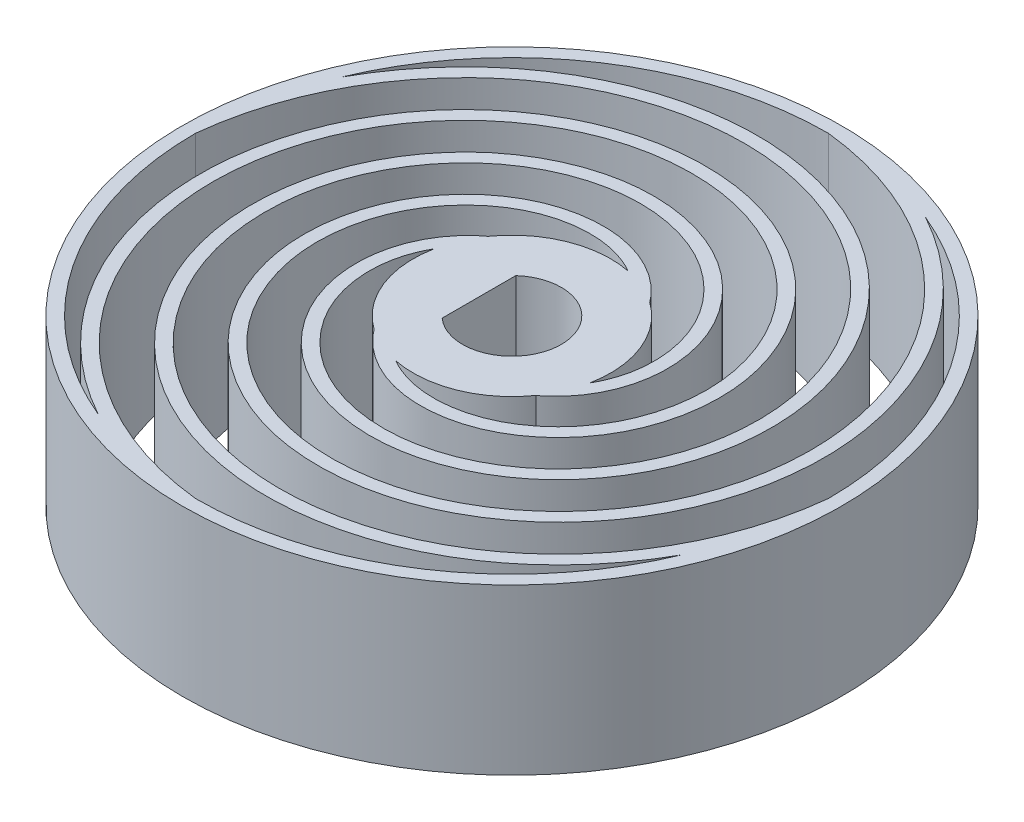
from build123d import *

# Parameters (mm, degrees)
SWEEP1_DEPTH        = 5
CIRPATTERN1_COUNT   = 4
SKETCH1_R           = 10
SKETCH1_R_2         = 9.6
SKETCH1_R_3         = 3
SKETCH1_R_4         = 1.5
BOSS_EXTRUDE1_DEPTH = 5
CUT_EXTRUDE1_DEPTH  = 5


# Read off the part's stored shape, not the designer's step: Sweep1
with BuildPart() as part:
    # Sweep1 outline → Sweep1 (new body)
    with BuildSketch(Plane(origin=(0, 0, 0), x_dir=(1, 0, 0), z_dir=(0, 1, 0))):
        with BuildLine():
            add(Edge.make_bspline(
                [(-9.997767253, 0.042204416), (-9.893548222, 1.024445624), (-9.643855436, 1.975253332), (-8.514500953, 4.619730854), (-7.250148261, 6.089394307), (-4.220454712, 8.034217024), (-2.465869735, 8.506161552), (0.899525972, 8.415541149), (2.500050194, 7.856354951), (5.039536559, 6.020831642), (5.972232345, 4.75284276), (6.951327861, 2.022470319), (6.997401809, 0.570143689), (6.315351727, -2.009640106), (5.592555924, -3.128989147), (3.739249202, -4.711480962), (2.61745741, -5.171210965), (0.421238612, -5.385789198), (-0.6444086, -5.14284378), (-2.363661266, -4.165013808), (-3.011596763, -3.436835308), (-3.744471685, -1.846203068), (-3.828769264, -0.992292459), (-3.523310038, 0.505264712), (-3.138015362, 1.141752965), (-2.151370993, 2.005668845), (-1.557863942, 2.230032974), (-0.453404495, 2.27341979), (0.04937349, 2.094819441), (0.756807528, 1.505326697), (0.956441656, 1.101049011), (0.984935122, 0.319516548), (0.808711828, -0.048952614), (0.355558233, -0.346460579), (0.179752495, -0.399999938), (0, -0.4)],
                knots=[0, 0, 0, 0, 0.03125, 0.03125, 0.09375, 0.09375, 0.15625, 0.15625, 0.21875, 0.21875, 0.28125, 0.28125, 0.34375, 0.34375, 0.40625, 0.40625, 0.46875, 0.46875, 0.53125, 0.53125, 0.59375, 0.59375, 0.65625, 0.65625, 0.71875, 0.71875, 0.78125, 0.78125, 0.84375, 0.84375, 0.90625, 0.90625, 0.96875, 0.96875, 1, 1, 1, 1], degree=3))
            Line((-9.997767253, 0.042204416), (-9.6, 0))
            add(Edge.make_bspline(
                [(-9.6, 0), (-9.500000002, 0.942477768), (-9.260276395, 1.854965201), (-8.178082578, 4.389012093), (-6.966588285, 5.79609643), (-4.07185486, 7.654285459), (-2.396315093, 8.104143661), (0.80843742, 8.017848911), (2.331018658, 7.48498264), (4.739932394, 5.743836325), (5.622987086, 4.541754089), (6.547526362, 1.963520879), (6.589948056, 0.593934112), (5.949379501, -1.82895008), (5.270769692, -2.877772985), (3.541549476, -4.354310455), (2.496772138, -4.781097682), (0.46413157, -4.979693743), (-0.518811459, -4.754107144), (-2.093750636, -3.858355877), (-2.683547792, -3.192955292), (-3.345933745, -1.755312325), (-3.419635874, -0.987893302), (-3.148583322, 0.340980176), (-2.807479524, 0.899505485), (-1.954895304, 1.646036894), (-1.447858478, 1.834045854), (-0.532007817, 1.870023456), (-0.1264769, 1.720682196), (0.420528321, 1.264871984), (0.561230213, 0.962417719), (0.580677698, 0.429001097), (0.461370534, 0.201510606), (0.199937884, 0.029872802), (0.099999829, 1.9e-08), (0, 0)],
                knots=[0, 0, 0, 0, 0.03125, 0.03125, 0.09375, 0.09375, 0.15625, 0.15625, 0.21875, 0.21875, 0.28125, 0.28125, 0.34375, 0.34375, 0.40625, 0.40625, 0.46875, 0.46875, 0.53125, 0.53125, 0.59375, 0.59375, 0.65625, 0.65625, 0.71875, 0.71875, 0.78125, 0.78125, 0.84375, 0.84375, 0.90625, 0.90625, 0.96875, 0.96875, 1, 1, 1, 1], degree=3))
            Line((0, 0), (0, -0.4))
        make_face()
    sweep1 = extrude(amount=SWEEP1_DEPTH)

    # CirPattern1: Sweep1 ×4 about axis
    cirpattern1_axis = Axis((0, 0, 0), (0, 1, 0))
    for i in range(1, CIRPATTERN1_COUNT):
        add(sweep1.rotate(cirpattern1_axis, i * 360 / CIRPATTERN1_COUNT))

    # Sketch1 → Boss-Extrude1 (add)
    # profile 1 of 3: a face of its own
    with BuildSketch(Plane(origin=(0, 0, 0), x_dir=(1, 0, 0), z_dir=(0, 1, 0))):
        with Locations(Location((0, 0, 0), (0, 0, 270))):
            Circle(SKETCH1_R)
        Circle(SKETCH1_R_2, mode=Mode.SUBTRACT)
    # profile 2 of 3: a face of its own
    with BuildSketch(Plane(origin=(0, 0, 0), x_dir=(1, 0, 0), z_dir=(0, 1, 0))):
        Circle(SKETCH1_R_3)
        Circle(SKETCH1_R_4, mode=Mode.SUBTRACT)
    # profile 3 of 3: a face of its own
    with BuildSketch(Plane(origin=(0, 0, 0), x_dir=(1, 0, 0), z_dir=(0, 1, 0))):
        with BuildLine():
            Line((-1, 0), (-1, 1.118033989))
            ThreePointArc((-1, 1.118033989), (-1.5, 0), (-1, -1.118033989))
            Line((-1, -1.118033989), (-1, 0))
        make_face()
    extrude(amount=BOSS_EXTRUDE1_DEPTH)

    # Sketch1<3> → Cut-Extrude1 (cut)
    with BuildSketch(Plane(origin=(0, 0, 0), x_dir=(1, 0, 0), z_dir=(0, 1, 0))):
        with BuildLine():
            ThreePointArc((1.5, 0), (0.612372436, 1.369306394), (-1, 1.118033989))
            Line((-1, 1.118033989), (-1, 0))
            Line((-1, 0), (-1, -1.118033989))
            ThreePointArc((-1, -1.118033989), (0.612372436, -1.369306394), (1.5, 0))
        make_face()
    extrude(amount=CUT_EXTRUDE1_DEPTH, mode=Mode.SUBTRACT)


solid = part.part
